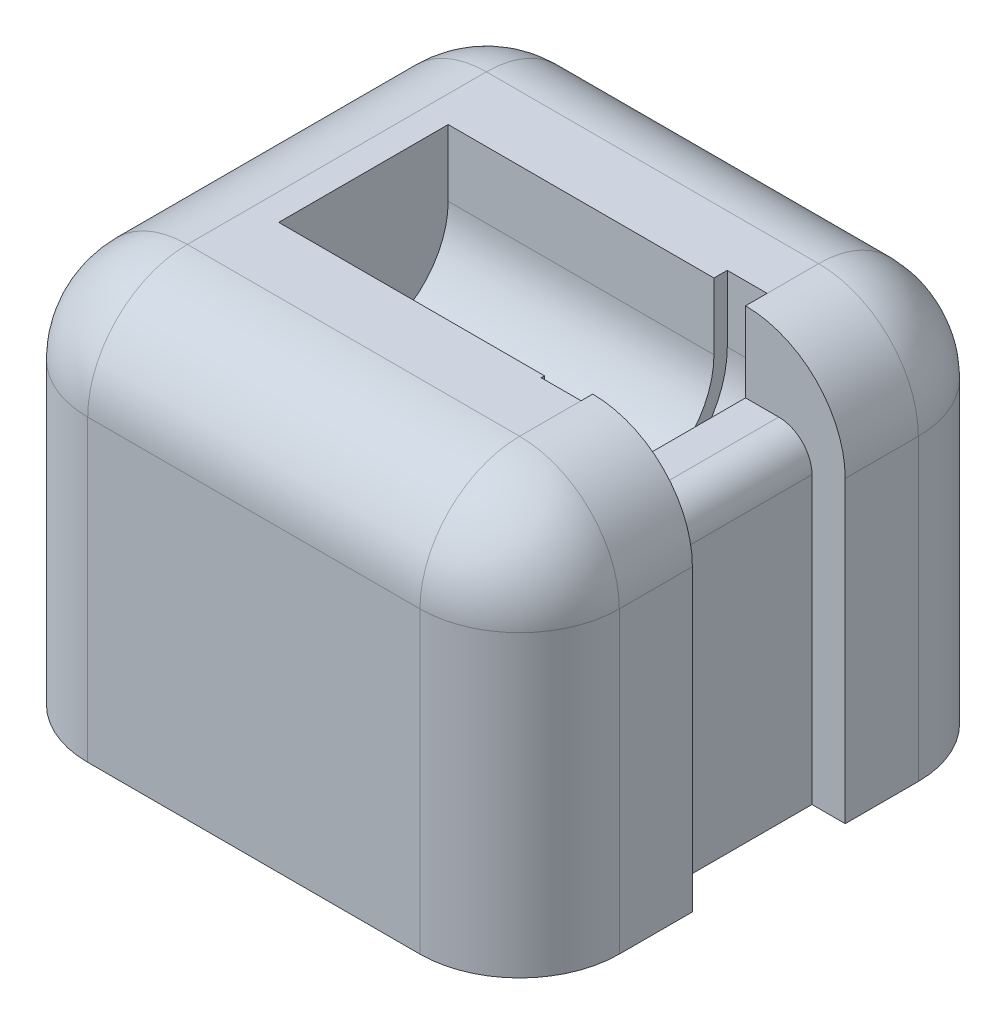
from build123d import *

# Parameters (mm, degrees)
SKETCH1_W           = 15
SKETCH1_H           = 15
BOSS_EXTRUDE1_DEPTH = 12
CUT_EXTRUDE1_DEPTH  = 2
CUT_EXTRUDE2_DEPTH  = 1.2
CUT_EXTRUDE3_DEPTH  = 8
SKETCH5_W           = 5.2
SKETCH5_H           = 12
BOSS_EXTRUDE2_DEPTH = 1
FILLET2_R           = 1
FILLET3_R           = 3
FILLET4_R           = 3


with BuildPart() as part:
    # Sketch1 → Boss-Extrude1 (new body)
    with BuildSketch(Plane(origin=(0, 0, 0), x_dir=(1, 0, 0), z_dir=(0, 1, 0))):
        Rectangle(SKETCH1_W, SKETCH1_H)
    extrude(amount=BOSS_EXTRUDE1_DEPTH)

    # Sketch2 → Cut-Extrude1 (cut)
    with BuildSketch(Plane(origin=(7.5, 0, 0), x_dir=(0, 0, -1), z_dir=(1, 0, 0))):
        Polygon((2.3, 10.4), (2.3, 9.6), (-2.3, 9.6), (-2.3, 10.4), (-2.3, 12), (2.3, 12), align=None)
    extrude(amount=-CUT_EXTRUDE1_DEPTH, mode=Mode.SUBTRACT)

    # Sketch3 → Cut-Extrude2 (cut)
    with BuildSketch(Plane(origin=(5.5, 0, 0), x_dir=(0, 0, -1), z_dir=(1, 0, 0))):
        with BuildLine():
            Line((-2.65, 11.29614814), (-2.65, 8.70385186))
            ThreePointArc((-2.65, 8.70385186), (0.665206735, 7.125978427), (2.95, 10))
            Line((2.95, 10), (2.95, 12))
            Line((2.95, 12), (-2.65, 12))
            Line((-2.65, 12), (-2.65, 11.29614814))
        make_face()
    extrude(amount=-CUT_EXTRUDE2_DEPTH, mode=Mode.SUBTRACT)

    # Sketch4 → Cut-Extrude3 (cut)
    with BuildSketch(Plane(origin=(4.3, 0, 0), x_dir=(0, 0, -1), z_dir=(1, 0, 0))):
        with BuildLine():
            Line((-2.55, 10), (-2.55, 12))
            Line((-2.55, 12), (2.55, 12))
            Line((2.55, 12), (2.55, 10))
            ThreePointArc((2.55, 10), (0, 7.45), (-2.55, 10))
        make_face()
    extrude(amount=-CUT_EXTRUDE3_DEPTH, mode=Mode.SUBTRACT)

    # Sketch5 → Boss-Extrude2 (add)
    with BuildSketch(Plane(origin=(7.5, 0, 0), x_dir=(0, 0, -1), z_dir=(1, 0, 0))):
        with Locations((4.9, 6)):
            Rectangle(SKETCH5_W, SKETCH5_H)
        with Locations((-4.9, 6)):
            Rectangle(SKETCH5_W, SKETCH5_H)
    extrude(amount=BOSS_EXTRUDE2_DEPTH)

    # Fillet2
    fillet2_edges = [part.edges().sort_by_distance(p)[0] for p in [
        (7.5, 9.6, 0),
    ]]
    fillet(fillet2_edges, radius=FILLET2_R)

    # Fillet3
    fillet3_edges = [part.edges().sort_by_distance(p)[0] for p in [
        (0.5, 12, -7.5),
        (-7.5, 12, 0),
        (8.5, 6, 7.5),
        (0.5, 12, 7.5),
        (-7.5, 6, -7.5),
        (8.5, 6, -7.5),
        (-7.5, 6, 7.5),
    ]]
    fillet(fillet3_edges, radius=FILLET3_R)

    # Fillet4
    # the kernel refuses this fillet: 3 mm, written as the material it takes off along each edge
    with BuildSketch(Plane(origin=(5.5, 9, 4.5), x_dir=(1, 0, 0), z_dir=(0, 1, 0))) as fillet4_piece_1_section:
        Polygon((0, 0), (FILLET4_R, 0), (FILLET4_R, -FILLET4_R), (0, -FILLET4_R), align=None)
    fillet4_piece_1 = extrude(amount=FILLET4_R, mode=Mode.PRIVATE)
    fillet4_piece_1 = fillet4_piece_1 - Plane(origin=(5.5, 9, 4.5), x_dir=(-0.7071067811865477, 0, -0.7071067811865475), z_dir=(0, 1, 0)) * Sphere(FILLET4_R, mode=Mode.PRIVATE)
    add(fillet4_piece_1, mode=Mode.SUBTRACT)
    with BuildSketch(Plane(origin=(5.5, 9, -4.5), x_dir=(1, 0, 0), z_dir=(0, 1, 0))) as fillet4_piece_2_section:
        Polygon((0, 0), (FILLET4_R, 0), (FILLET4_R, FILLET4_R), (0, FILLET4_R), align=None)
    fillet4_piece_2 = extrude(amount=FILLET4_R, mode=Mode.PRIVATE)
    fillet4_piece_2 = fillet4_piece_2 - Plane(origin=(5.5, 9, -4.5), x_dir=(-0.7071067811865475, 0, 0.7071067811865476), z_dir=(0, 1, 0)) * Sphere(FILLET4_R, mode=Mode.PRIVATE)
    add(fillet4_piece_2, mode=Mode.SUBTRACT)
    with BuildSketch(Plane(origin=(8.5, 12, -5.2), x_dir=(-1, 0, 0), z_dir=(0, 0, 1)), Plane(origin=(8.5, 12, -4.5), x_dir=(-1, 0, 0), z_dir=(0, 0, 1))) as fillet4_piece_3:
        with BuildLine():
            CenterArc((FILLET4_R, FILLET4_R), FILLET4_R, 180, 90)
            Line((0, FILLET4_R), (0, 0))
            Line((0, 0), (FILLET4_R, 0))
        make_face()
    extrude(amount=9.7, mode=Mode.SUBTRACT)


solid = part.part
